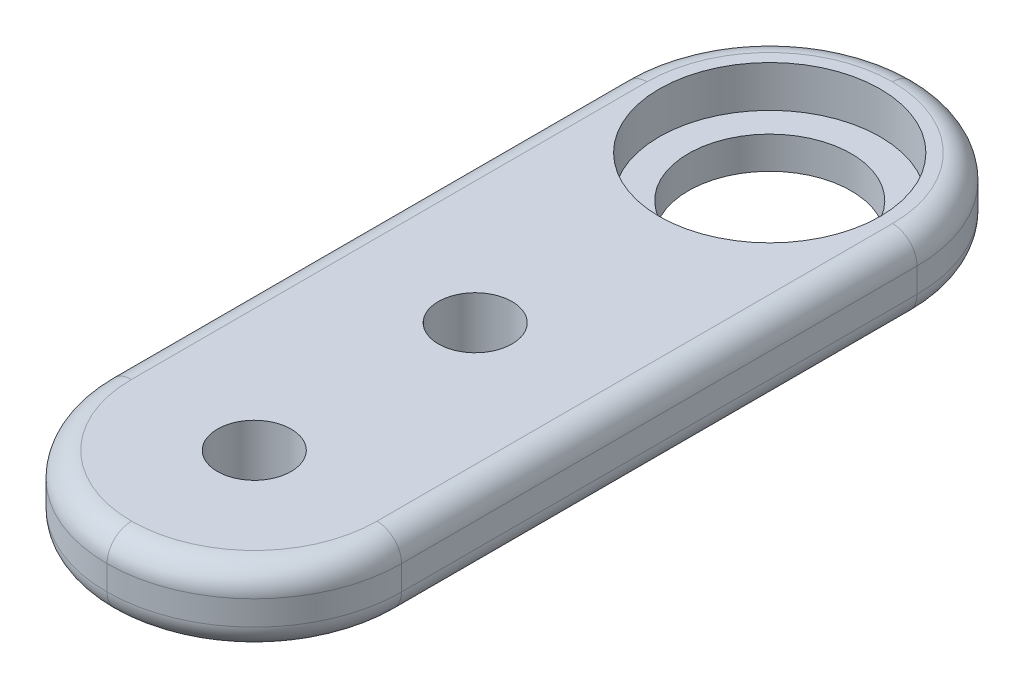
from build123d import *

# Parameters (mm, degrees)
SKETCH1_W           = 25.4
SKETCH1_H           = 69.85
SKETCH1_R           = 3.175
BOSS_EXTRUDE1_DEPTH = 6.35
FILLET1_R           = 12.7
FILLET2_R           = 2.116666667
SKETCH5_R           = 9.525
SKETCH5_R_2         = 7.016807895
CUT_EXTRUDE2_DEPTH  = 3.571875
SKETCH5_2_R         = 7.016807895
CUT_EXTRUDE3_DEPTH  = 6.35


with BuildPart() as part:
    # Sketch1 → Boss-Extrude1 (new body)
    with BuildSketch(Plane(origin=(0, 0, 0), x_dir=(1, 0, 0), z_dir=(0, 1, 0))):
        Rectangle(SKETCH1_W, SKETCH1_H)
        with Locations(Location((0, -3.175, 0), (0, 0, 270))):
            Circle(SKETCH1_R, mode=Mode.SUBTRACT)
        with Locations(Location((0, -22.225, 0), (0, 0, 270))):
            Circle(SKETCH1_R, mode=Mode.SUBTRACT)
    extrude(amount=BOSS_EXTRUDE1_DEPTH)

    # Fillet1
    fillet1_edges = [part.edges().sort_by_distance(p)[0] for p in [
        (-12.7, 3.175, -34.925),
        (12.7, 3.175, -34.925),
        (-12.7, 3.175, 34.925),
        (12.7, 3.175, 34.925),
    ]]
    fillet(fillet1_edges, radius=FILLET1_R - 0.0001)  # a hair under: the kernel refuses the full size

    # Fillet2
    fillet2_edges = [part.edges().sort_by_distance(p)[0] for p in [
        (-12.7, 0, 0),
        (-12.7, 6.35, 0),
        (12.7, 0, 0),
        (8.98028541, 0, 31.20528541),
        (-8.98028541, 0, 31.20528541),
        (8.98028541, 0, -31.20528541),
        (-8.98028541, 0, -31.20528541),
        (12.7, 6.35, 0),
        (8.98028541, 6.35, 31.20528541),
        (-8.98028541, 6.35, 31.20528541),
        (8.98028541, 6.35, -31.20528541),
        (-8.98028541, 6.35, -31.20528541),
    ]]
    fillet(fillet2_edges, radius=FILLET2_R)

    # Sketch5 → Cut-Extrude2 (cut)
    with BuildSketch(Plane(origin=(0, 6.35, 0), x_dir=(1, 0, 0), z_dir=(0, 1, 0))):
        with Locations(Location((0, 22.225, 0), (0, 0, 270))):
            Circle(SKETCH5_R)
        with Locations(Location((0, 22.225, 0), (0, 0, 270))):
            Circle(SKETCH5_R_2, mode=Mode.SUBTRACT)
    extrude(amount=-CUT_EXTRUDE2_DEPTH, mode=Mode.SUBTRACT)

    # Sketch5<2> → Cut-Extrude3 (cut)
    with BuildSketch(Plane(origin=(0, 6.35, 0), x_dir=(1, 0, 0), z_dir=(0, 1, 0))):
        with Locations(Location((0, 22.225, 0), (0, 0, 270))):
            Circle(SKETCH5_2_R)
    extrude(amount=-CUT_EXTRUDE3_DEPTH, mode=Mode.SUBTRACT)


solid = part.part
